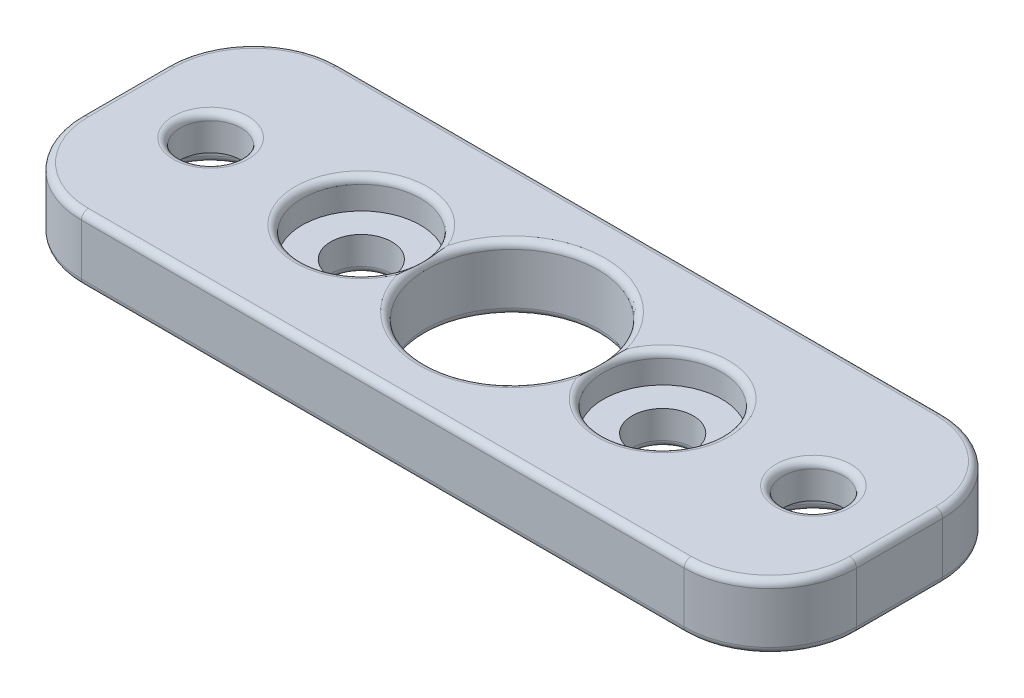
from build123d import *

# Parameters (mm, degrees)
SKETCH1_W                                      = 57.15
SKETCH1_H                                      = 19.05
SKETCH1_R                                      = 6.35
BOSS_EXTRUDE1_DEPTH                            = 4.7625
CBORE_FOR_8_BUTTON_HEAD_CAP_SCREW1_D           = 4.4958
CBORE_FOR_8_BUTTON_HEAD_CAP_SCREW1_CBORE_D     = 8.73252
CBORE_FOR_8_BUTTON_HEAD_CAP_SCREW1_CBORE_DEPTH = 2.2098
CBORE_FOR_8_BUTTON_HEAD_CAP_SCREW2_D           = 4.4958
CBORE_FOR_8_BUTTON_HEAD_CAP_SCREW2_CBORE_D     = 8.73252
CBORE_FOR_8_BUTTON_HEAD_CAP_SCREW2_CBORE_DEPTH = 2.2098
FILLET1_R                                      = 6.35
FILLET2_R                                      = 0.508


with BuildPart() as part:
    # Sketch1 → Boss-Extrude1 (new body)
    with BuildSketch(Plane(origin=(0, 0, 0), x_dir=(1, 0, 0), z_dir=(0, 1, 0))):
        Rectangle(SKETCH1_W, SKETCH1_H)
        with Locations(Location((0, 0, 0), (0, 0, 90))):
            Circle(SKETCH1_R, mode=Mode.SUBTRACT)
    extrude(amount=BOSS_EXTRUDE1_DEPTH)

    # CBORE for #8 Button Head Cap Screw1 (through all)
    with Locations(Plane(origin=(0, 4.7625, 0), x_dir=(1, 0, 0), z_dir=(0, 1, 0))):
        with Locations((-11.1125, 0), (11.1125, 0)):
            CounterBoreHole(CBORE_FOR_8_BUTTON_HEAD_CAP_SCREW1_D / 2, CBORE_FOR_8_BUTTON_HEAD_CAP_SCREW1_CBORE_D / 2, CBORE_FOR_8_BUTTON_HEAD_CAP_SCREW1_CBORE_DEPTH)

    # CBORE for #8 Button Head Cap Screw2 (through all)
    with Locations(Plane(origin=(0, 0, 0), x_dir=(-1, 0, 0), z_dir=(0, -1, 0))):
        with Locations((22.225, 0), (-22.225, 0)):
            CounterBoreHole(CBORE_FOR_8_BUTTON_HEAD_CAP_SCREW2_D / 2, CBORE_FOR_8_BUTTON_HEAD_CAP_SCREW2_CBORE_D / 2, CBORE_FOR_8_BUTTON_HEAD_CAP_SCREW2_CBORE_DEPTH)

    # Fillet1
    fillet1_edges = [part.edges().sort_by_distance(p)[0] for p in [
        (28.575, 2.38125, 9.525),
        (-28.575, 2.38125, 9.525),
        (-28.575, 2.38125, -9.525),
        (28.575, 2.38125, -9.525),
    ]]
    fillet(fillet1_edges, radius=FILLET1_R)

    # Fillet2
    # the kernel refuses this fillet: 0.508 mm, written as the material it takes off along each edge
    with BuildSketch(Plane(origin=(0, 0, 0), x_dir=(0, 0, -1), z_dir=(1, 0, 0))) as fillet2_piece_1:
        with BuildLine():
            CenterArc((6.35 + FILLET2_R, FILLET2_R), FILLET2_R, 180, 90)
            Line((6.35, FILLET2_R), (6.35, 0))
            Line((6.35, 0), (6.35 + FILLET2_R, 0))
        make_face()
    revolve(axis=Axis((0, 0, 0), (0, 1, 0)), mode=Mode.SUBTRACT)
    with BuildSketch(Plane(origin=(0, 4.7625, 0), x_dir=(0, 0, -1), z_dir=(1, 0, 0))) as fillet2_piece_2:
        with BuildLine():
            CenterArc((6.35 + FILLET2_R, -FILLET2_R), FILLET2_R, 90, 90)
            Line((6.35, -FILLET2_R), (6.35, 0))
            Line((6.35, 0), (6.35 + FILLET2_R, 0))
        make_face()
    revolve(axis=Axis((0, 4.7625, 0), (0, 1, 0)), mode=Mode.SUBTRACT)
    with BuildSketch(Plane(origin=(11.1125, 4.7625, 0), x_dir=(1, 0, 0), z_dir=(0, 0, 1))) as fillet2_piece_3:
        with BuildLine():
            CenterArc((4.36626 + FILLET2_R, -FILLET2_R), FILLET2_R, 90, 90)
            Line((4.36626, -FILLET2_R), (4.36626, 0))
            Line((4.36626, 0), (4.36626 + FILLET2_R, 0))
        make_face()
    revolve(axis=Axis((11.1125, 4.7625, 0), (0, 1, 0)), mode=Mode.SUBTRACT)
    with BuildSketch(Plane(origin=(11.1125, 0, 0), x_dir=(-1, 0, 0), z_dir=(0, 0, 1))) as fillet2_piece_4:
        with BuildLine():
            CenterArc((2.2479 + FILLET2_R, -FILLET2_R), FILLET2_R, 90, 90)
            Line((2.2479, -FILLET2_R), (2.2479, 0))
            Line((2.2479, 0), (2.2479 + FILLET2_R, 0))
        make_face()
    revolve(axis=Axis((11.1125, 0, 0), (0, -1, 0)), mode=Mode.SUBTRACT)
    with BuildSketch(Plane(origin=(-11.1125, 4.7625, 0), x_dir=(1, 0, 0), z_dir=(0, 0, 1))) as fillet2_piece_5:
        with BuildLine():
            CenterArc((4.36626 + FILLET2_R, -FILLET2_R), FILLET2_R, 90, 90)
            Line((4.36626, -FILLET2_R), (4.36626, 0))
            Line((4.36626, 0), (4.36626 + FILLET2_R, 0))
        make_face()
    revolve(axis=Axis((-11.1125, 4.7625, 0), (0, 1, 0)), mode=Mode.SUBTRACT)
    with BuildSketch(Plane(origin=(-11.1125, 0, 0), x_dir=(-1, 0, 0), z_dir=(0, 0, 1))) as fillet2_piece_6:
        with BuildLine():
            CenterArc((2.2479 + FILLET2_R, -FILLET2_R), FILLET2_R, 90, 90)
            Line((2.2479, -FILLET2_R), (2.2479, 0))
            Line((2.2479, 0), (2.2479 + FILLET2_R, 0))
        make_face()
    revolve(axis=Axis((-11.1125, 0, 0), (0, -1, 0)), mode=Mode.SUBTRACT)
    with BuildSketch(Plane(origin=(22.225, 0, 0), x_dir=(-1, 0, 0), z_dir=(0, 0, 1))) as fillet2_piece_7:
        with BuildLine():
            CenterArc((4.36626 + FILLET2_R, -FILLET2_R), FILLET2_R, 90, 90)
            Line((4.36626, -FILLET2_R), (4.36626, 0))
            Line((4.36626, 0), (4.36626 + FILLET2_R, 0))
        make_face()
    revolve(axis=Axis((22.225, 0, 0), (0, -1, 0)), mode=Mode.SUBTRACT)
    with BuildSketch(Plane(origin=(22.225, 4.7625, 0), x_dir=(1, 0, 0), z_dir=(0, 0, 1))) as fillet2_piece_8:
        with BuildLine():
            CenterArc((2.2479 + FILLET2_R, -FILLET2_R), FILLET2_R, 90, 90)
            Line((2.2479, -FILLET2_R), (2.2479, 0))
            Line((2.2479, 0), (2.2479 + FILLET2_R, 0))
        make_face()
    revolve(axis=Axis((22.225, 4.7625, 0), (0, 1, 0)), mode=Mode.SUBTRACT)
    with BuildSketch(Plane(origin=(-22.225, 0, 0), x_dir=(-1, 0, 0), z_dir=(0, 0, 1))) as fillet2_piece_9:
        with BuildLine():
            CenterArc((4.36626 + FILLET2_R, -FILLET2_R), FILLET2_R, 90, 90)
            Line((4.36626, -FILLET2_R), (4.36626, 0))
            Line((4.36626, 0), (4.36626 + FILLET2_R, 0))
        make_face()
    revolve(axis=Axis((-22.225, 0, 0), (0, -1, 0)), mode=Mode.SUBTRACT)
    with BuildSketch(Plane(origin=(-22.225, 4.7625, 0), x_dir=(1, 0, 0), z_dir=(0, 0, 1))) as fillet2_piece_10:
        with BuildLine():
            CenterArc((2.2479 + FILLET2_R, -FILLET2_R), FILLET2_R, 90, 90)
            Line((2.2479, -FILLET2_R), (2.2479, 0))
            Line((2.2479, 0), (2.2479 + FILLET2_R, 0))
        make_face()
    revolve(axis=Axis((-22.225, 4.7625, 0), (0, 1, 0)), mode=Mode.SUBTRACT)
    with BuildSketch(Plane(origin=(22.225, 0, -9.525), x_dir=(0, 0, 1), z_dir=(-1, 0, 0)), Plane(origin=(-22.225, 4.7625, 9.525), x_dir=(0, -1, 0), z_dir=(1, 0, 0))) as fillet2_piece_11:
        with BuildLine():
            CenterArc((FILLET2_R, FILLET2_R), FILLET2_R, 180, 90)
            Line((0, FILLET2_R), (0, 0))
            Line((0, 0), (FILLET2_R, 0))
        make_face()
    extrude(amount=44.45, mode=Mode.SUBTRACT)
    with BuildSketch(Plane(origin=(22.225, 4.7625, -9.525), x_dir=(0, 0, 1), z_dir=(-1, 0, 0)), Plane(origin=(-22.225, 0, 9.525), x_dir=(0, 1, 0), z_dir=(1, 0, 0))) as fillet2_piece_12:
        with BuildLine():
            CenterArc((FILLET2_R, -FILLET2_R), FILLET2_R, 90, 90)
            Line((0, -FILLET2_R), (0, 0))
            Line((0, 0), (FILLET2_R, 0))
        make_face()
    extrude(amount=44.45, mode=Mode.SUBTRACT)
    with BuildSketch(Plane(origin=(28.575, 0, 3.175), x_dir=(-1, 0, 0), z_dir=(0, 0, -1)), Plane(origin=(-28.575, 0, -3.175), x_dir=(1, 0, 0), z_dir=(0, 0, 1))) as fillet2_piece_13:
        with BuildLine():
            CenterArc((FILLET2_R, FILLET2_R), FILLET2_R, 180, 90)
            Line((0, FILLET2_R), (0, 0))
            Line((0, 0), (FILLET2_R, 0))
        make_face()
    extrude(amount=6.35, mode=Mode.SUBTRACT)
    with BuildSketch(Plane(origin=(-22.225, 0, 3.175), x_dir=(0, 0, 1), z_dir=(1, 0, 0))) as fillet2_piece_14:
        with BuildLine():
            CenterArc((6.35 - FILLET2_R, -FILLET2_R), FILLET2_R, 0, 90)
            Line((6.35, -FILLET2_R), (6.35, 0))
            Line((6.35, 0), (6.35 - FILLET2_R, 0))
        make_face()
    revolve(axis=Axis((-22.225, 0, 3.175), (0, -1, 0)), revolution_arc=90, mode=Mode.SUBTRACT)
    with BuildSketch(Plane(origin=(-22.225, 0, -3.175), x_dir=(-1, 0, 0), z_dir=(0, 0, 1))) as fillet2_piece_15:
        with BuildLine():
            CenterArc((6.35 - FILLET2_R, -FILLET2_R), FILLET2_R, 0, 90)
            Line((6.35, -FILLET2_R), (6.35, 0))
            Line((6.35, 0), (6.35 - FILLET2_R, 0))
        make_face()
    revolve(axis=Axis((-22.225, 0, -3.175), (0, -1, 0)), revolution_arc=90, mode=Mode.SUBTRACT)
    with BuildSketch(Plane(origin=(22.225, 0, 3.175), x_dir=(0, 0, 1), z_dir=(-1, 0, 0))) as fillet2_piece_16:
        with BuildLine():
            CenterArc((6.35 - FILLET2_R, FILLET2_R), FILLET2_R, 270, 90)
            Line((6.35, FILLET2_R), (6.35, 0))
            Line((6.35, 0), (6.35 - FILLET2_R, 0))
        make_face()
    revolve(axis=Axis((22.225, 0, 3.175), (0, 1, 0)), revolution_arc=90, mode=Mode.SUBTRACT)
    with BuildSketch(Plane(origin=(22.225, 0, -3.175), x_dir=(1, 0, 0), z_dir=(0, 0, 1))) as fillet2_piece_17:
        with BuildLine():
            CenterArc((6.35 - FILLET2_R, FILLET2_R), FILLET2_R, 270, 90)
            Line((6.35, FILLET2_R), (6.35, 0))
            Line((6.35, 0), (6.35 - FILLET2_R, 0))
        make_face()
    revolve(axis=Axis((22.225, 0, -3.175), (0, 1, 0)), revolution_arc=90, mode=Mode.SUBTRACT)
    with BuildSketch(Plane(origin=(28.575, 4.7625, 3.175), x_dir=(-1, 0, 0), z_dir=(0, 0, -1)), Plane(origin=(-28.575, 4.7625, -3.175), x_dir=(1, 0, 0), z_dir=(0, 0, 1))) as fillet2_piece_18:
        with BuildLine():
            CenterArc((FILLET2_R, -FILLET2_R), FILLET2_R, 90, 90)
            Line((0, -FILLET2_R), (0, 0))
            Line((0, 0), (FILLET2_R, 0))
        make_face()
    extrude(amount=6.35, mode=Mode.SUBTRACT)
    with BuildSketch(Plane(origin=(-22.225, 4.7625, 3.175), x_dir=(0, 0, 1), z_dir=(1, 0, 0))) as fillet2_piece_19:
        with BuildLine():
            CenterArc((6.35 - FILLET2_R, FILLET2_R), FILLET2_R, 270, 90)
            Line((6.35 - FILLET2_R, 0), (6.35, 0))
            Line((6.35, 0), (6.35, FILLET2_R))
        make_face()
    revolve(axis=Axis((-22.225, 4.7625, 3.175), (0, -1, 0)), revolution_arc=90, mode=Mode.SUBTRACT)
    with BuildSketch(Plane(origin=(-22.225, 4.7625, -3.175), x_dir=(-1, 0, 0), z_dir=(0, 0, 1))) as fillet2_piece_20:
        with BuildLine():
            CenterArc((6.35 - FILLET2_R, FILLET2_R), FILLET2_R, 270, 90)
            Line((6.35, FILLET2_R), (6.35, 0))
            Line((6.35, 0), (6.35 - FILLET2_R, 0))
        make_face()
    revolve(axis=Axis((-22.225, 4.7625, -3.175), (0, -1, 0)), revolution_arc=90, mode=Mode.SUBTRACT)
    with BuildSketch(Plane(origin=(22.225, 4.7625, 3.175), x_dir=(0, 0, 1), z_dir=(-1, 0, 0))) as fillet2_piece_21:
        with BuildLine():
            CenterArc((6.35 - FILLET2_R, -FILLET2_R), FILLET2_R, 0, 90)
            Line((6.35 - FILLET2_R, 0), (6.35, 0))
            Line((6.35, 0), (6.35, -FILLET2_R))
        make_face()
    revolve(axis=Axis((22.225, 4.7625, 3.175), (0, 1, 0)), revolution_arc=90, mode=Mode.SUBTRACT)
    with BuildSketch(Plane(origin=(22.225, 4.7625, -3.175), x_dir=(1, 0, 0), z_dir=(0, 0, 1))) as fillet2_piece_22:
        with BuildLine():
            CenterArc((6.35 - FILLET2_R, -FILLET2_R), FILLET2_R, 0, 90)
            Line((6.35, -FILLET2_R), (6.35, 0))
            Line((6.35, 0), (6.35 - FILLET2_R, 0))
        make_face()
    revolve(axis=Axis((22.225, 4.7625, -3.175), (0, 1, 0)), revolution_arc=90, mode=Mode.SUBTRACT)


solid = part.part
